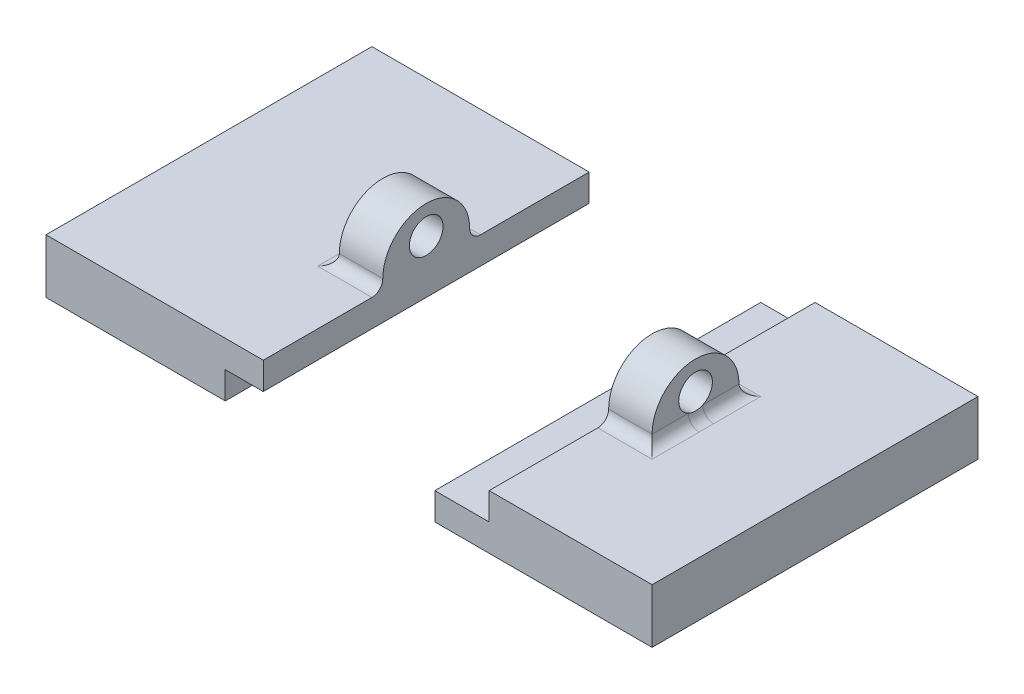
from build123d import *

# Parameters (mm, degrees)
SKETCH1_W             = 20
SKETCH1_H             = 30
BOSS_EXTRUDE1_DEPTH   = 5
BOSS_EXTRUDE1_2_DEPTH = 5
SKETCH2_W             = 30
SKETCH2_H             = 2.5
CUT_EXTRUDE1_DEPTH    = 3.5
SKETCH3_W             = 30
SKETCH3_H             = 2.5
CUT_EXTRUDE2_DEPTH    = 5
SKETCH4_R             = 1.55
BOSS_EXTRUDE2_DEPTH   = 4
FILLET1_R             = 1
SKETCH5_R             = 1.55
BOSS_EXTRUDE3_DEPTH   = 4
FILLET2_R             = 1


with BuildPart() as part:
    # Sketch1 → Boss-Extrude1 (new body)
    with BuildSketch(Plane(origin=(0, 0, 0), x_dir=(1, 0, 0), z_dir=(0, 1, 0))):
        with Locations((-10, 15)):
            Rectangle(SKETCH1_W, SKETCH1_H)
    extrude(amount=BOSS_EXTRUDE1_DEPTH)

    # Sketch2 → Cut-Extrude1 (cut)
    with BuildSketch(Plane(origin=(0, 0, 0), x_dir=(0, 0, -1), z_dir=(1, 0, 0))):
        with Locations((15, 1.25)):
            Rectangle(SKETCH2_W, SKETCH2_H)
    extrude(amount=-CUT_EXTRUDE1_DEPTH, mode=Mode.SUBTRACT)

    # Sketch5 → Boss-Extrude3 (add)
    with BuildSketch(Plane(origin=(0, 0, 0), x_dir=(0, 0, -1), z_dir=(1, 0, 0))):
        with BuildLine():
            Line((11, 5), (19, 5))
            Line((19, 5), (19, 6))
            ThreePointArc((19, 6), (15, 10), (11, 6))
            Line((11, 6), (11, 5))
        make_face()
        with Locations(Location((15, 7.4, 0), (0, 0, 180))):
            Circle(SKETCH5_R, mode=Mode.SUBTRACT)
    extrude(amount=-BOSS_EXTRUDE3_DEPTH)

    # Fillet2
    fillet2_edges = [part.edges().sort_by_distance(p)[0] for p in [
        (-2, 5, -11),
        (-4, 5, -15),
        (-2, 5, -19),
    ]]
    fillet(fillet2_edges, radius=FILLET2_R - 0.0001)  # a hair under: the kernel refuses the full size


with BuildPart() as body_2:
    # Sketch1 → Boss-Extrude1 2 (new body)
    with BuildSketch(Plane(origin=(0, 0, 0), x_dir=(1, 0, 0), z_dir=(0, 1, 0))):
        with Locations((25.791271198, 15)):
            Rectangle(SKETCH1_W, SKETCH1_H)
    extrude(amount=BOSS_EXTRUDE1_2_DEPTH)

    # Sketch3 → Cut-Extrude2 (cut)
    with BuildSketch(Plane.ZY.offset(-15.791271198)):
        with Locations((-15, 3.75)):
            Rectangle(SKETCH3_W, SKETCH3_H)
    extrude(amount=-CUT_EXTRUDE2_DEPTH, mode=Mode.SUBTRACT)

    # Sketch4 → Boss-Extrude2 (add)
    with BuildSketch(Plane.ZY.offset(-20.791271198)):
        with BuildLine():
            Line((-19, 5), (-11, 5))
            Line((-11, 5), (-11, 6))
            ThreePointArc((-11, 6), (-15, 10), (-19, 6))
            Line((-19, 6), (-19, 5))
        make_face()
        with Locations((-15, 7.4)):
            Circle(SKETCH4_R, mode=Mode.SUBTRACT)
    extrude(amount=-BOSS_EXTRUDE2_DEPTH)

    # Fillet1
    fillet1_edges = [body_2.edges().sort_by_distance(p)[0] for p in [
        (22.791271198, 5, -19),
        (24.791271198, 5, -15),
        (22.791271198, 5, -11),
    ]]
    fillet(fillet1_edges, radius=FILLET1_R - 0.0001)  # a hair under: the kernel refuses the full size


solid = Compound([part.part, body_2.part])
